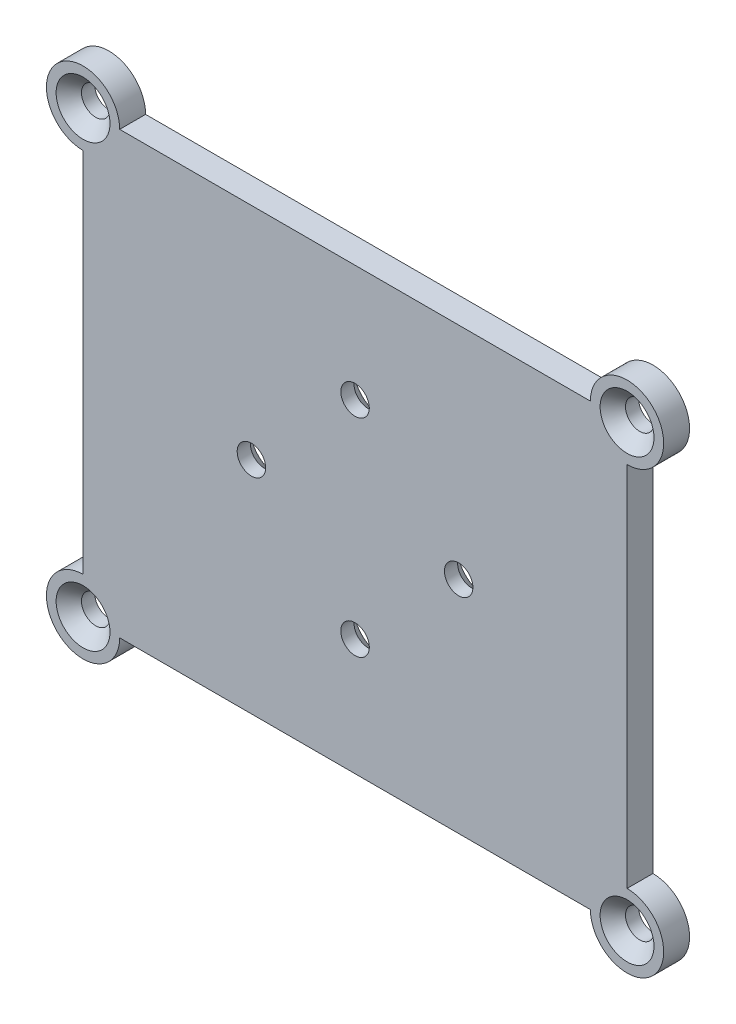
from build123d import *

# Parameters (mm, degrees)
SKETCH1_W                                      = 75
SKETCH1_H                                      = 95
SKETCH1_R                                      = 1
BOSS_EXTRUDE1_DEPTH                            = 5
CSK_FOR_M5_FLAT_HEAD_MACHINE_SCREW1_AT_2_COUNT = 2
CSK_FOR_M5_FLAT_HEAD_MACHINE_SCREW1_AT_2_PITCH = 28.284271247
CSK_FOR_M5_FLAT_HEAD_MACHINE_SCREW1_AT_3_COUNT = 2
CSK_FOR_M5_FLAT_HEAD_MACHINE_SCREW1_AT_3_PITCH = 40
CSK_FOR_M5_FLAT_HEAD_MACHINE_SCREW1_AT_4_COUNT = 2
CSK_FOR_M5_FLAT_HEAD_MACHINE_SCREW1_AT_4_PITCH = 28.284271247
SKETCH3_W                                      = 95
SKETCH3_H                                      = 75
BOSS_EXTRUDE2_DEPTH                            = 5
CSK_FOR_M5_FLAT_HEAD_MACHINE_SCREW2_AT_2_COUNT = 2
CSK_FOR_M5_FLAT_HEAD_MACHINE_SCREW2_AT_2_PITCH = 105
CSK_FOR_M5_FLAT_HEAD_MACHINE_SCREW2_AT_3_COUNT = 2
CSK_FOR_M5_FLAT_HEAD_MACHINE_SCREW2_AT_3_PITCH = 135.092560861
CSK_FOR_M5_FLAT_HEAD_MACHINE_SCREW2_AT_4_COUNT = 2
CSK_FOR_M5_FLAT_HEAD_MACHINE_SCREW2_AT_4_PITCH = 85


with BuildPart() as part:
    # Sketch1 → Boss-Extrude1 (new body)
    with BuildSketch(Plane(origin=(0, 0, 0), x_dir=(0, 1, 0), z_dir=(0, 0, 1))):
        Rectangle(SKETCH1_W, SKETCH1_H)
        with Locations((0, 20)):
            Circle(SKETCH1_R, mode=Mode.SUBTRACT)
        with Locations((20, 0)):
            Circle(SKETCH1_R, mode=Mode.SUBTRACT)
        with Locations((0, -20)):
            Circle(SKETCH1_R, mode=Mode.SUBTRACT)
        with Locations((-20, 0)):
            Circle(SKETCH1_R, mode=Mode.SUBTRACT)
    extrude(amount=BOSS_EXTRUDE1_DEPTH)

    # Sketch2 → CSK for M5 Flat Head Machine Screw1 (revolve, cut)
    with BuildSketch(Plane(origin=(0, 20, 0), x_dir=(0, 1, 0), z_dir=(1, 0, 0))):
        Polygon((0, 0), (0, 5), (2.75, 5), (2.75, 2.45), (5.2, 0), align=None)
    csk_for_m5_flat_head_machine_screw1 = revolve(axis=Axis((0, 20, -6.35), (0, 0, 1)), mode=Mode.SUBTRACT)

    # CSK for M5 Flat Head Machine Screw1 at 2: CSK for M5 Flat Head Machine Screw1 ×2
    with Locations(*[Vector(-0.7071067811865475, -0.7071067811865477, 0) * (i * CSK_FOR_M5_FLAT_HEAD_MACHINE_SCREW1_AT_2_PITCH) for i in range(1, CSK_FOR_M5_FLAT_HEAD_MACHINE_SCREW1_AT_2_COUNT)]):
        add(csk_for_m5_flat_head_machine_screw1, mode=Mode.SUBTRACT)

    # CSK for M5 Flat Head Machine Screw1 at 3: CSK for M5 Flat Head Machine Screw1 ×2
    with Locations(*[(0, -i * CSK_FOR_M5_FLAT_HEAD_MACHINE_SCREW1_AT_3_PITCH, 0) for i in range(1, CSK_FOR_M5_FLAT_HEAD_MACHINE_SCREW1_AT_3_COUNT)]):
        add(csk_for_m5_flat_head_machine_screw1, mode=Mode.SUBTRACT)

    # CSK for M5 Flat Head Machine Screw1 at 4: CSK for M5 Flat Head Machine Screw1 ×2
    with Locations(*[Vector(0.7071067811865478, -0.7071067811865472, 0) * (i * CSK_FOR_M5_FLAT_HEAD_MACHINE_SCREW1_AT_4_PITCH) for i in range(1, CSK_FOR_M5_FLAT_HEAD_MACHINE_SCREW1_AT_4_COUNT)]):
        add(csk_for_m5_flat_head_machine_screw1, mode=Mode.SUBTRACT)

    # Sketch3 → Boss-Extrude2 (add)
    with BuildSketch(Plane.XY.offset(5)):
        with BuildLine():
            ThreePointArc((-52.5, -35.428932188), (-57.5, -47.5), (-45.428932188, -42.5))
            Line((-45.428932188, -42.5), (45.428932188, -42.5))
            ThreePointArc((45.428932188, -42.5), (57.5, -47.5), (52.5, -35.428932188))
            Line((52.5, -35.428932188), (52.5, 35.428932188))
            ThreePointArc((52.5, 35.428932188), (57.5, 47.5), (45.428932188, 42.5))
            Line((45.428932188, 42.5), (-45.428932188, 42.5))
            ThreePointArc((-45.428932188, 42.5), (-57.5, 47.5), (-52.5, 35.428932188))
            Line((-52.5, 35.428932188), (-52.5, -35.428932188))
        make_face()
        Rectangle(SKETCH3_W, SKETCH3_H, mode=Mode.SUBTRACT)
    extrude(amount=-BOSS_EXTRUDE2_DEPTH)

    # Sketch5 → CSK for M5 Flat Head Machine Screw2 (revolve, cut)
    with BuildSketch(Plane(origin=(-52.5, 42.5, 5), x_dir=(0, -1, 0), z_dir=(1, 0, 0))):
        Polygon((0, 0), (0, 5), (2.75, 5), (2.75, 2.45), (5.2, 0), align=None)
    csk_for_m5_flat_head_machine_screw2 = revolve(axis=Axis((-52.5, 42.5, 11.35), (0, 0, -1)), mode=Mode.SUBTRACT)

    # CSK for M5 Flat Head Machine Screw2 at 2: CSK for M5 Flat Head Machine Screw2 ×2
    with Locations(*[(i * CSK_FOR_M5_FLAT_HEAD_MACHINE_SCREW2_AT_2_PITCH, 0, 0) for i in range(1, CSK_FOR_M5_FLAT_HEAD_MACHINE_SCREW2_AT_2_COUNT)]):
        add(csk_for_m5_flat_head_machine_screw2, mode=Mode.SUBTRACT)

    # CSK for M5 Flat Head Machine Screw2 at 3: CSK for M5 Flat Head Machine Screw2 ×2
    with Locations(*[Vector(0.7772448707074855, -0.6291982286679645, 0) * (i * CSK_FOR_M5_FLAT_HEAD_MACHINE_SCREW2_AT_3_PITCH) for i in range(1, CSK_FOR_M5_FLAT_HEAD_MACHINE_SCREW2_AT_3_COUNT)]):
        add(csk_for_m5_flat_head_machine_screw2, mode=Mode.SUBTRACT)

    # CSK for M5 Flat Head Machine Screw2 at 4: CSK for M5 Flat Head Machine Screw2 ×2
    with Locations(*[(0, -i * CSK_FOR_M5_FLAT_HEAD_MACHINE_SCREW2_AT_4_PITCH, 0) for i in range(1, CSK_FOR_M5_FLAT_HEAD_MACHINE_SCREW2_AT_4_COUNT)]):
        add(csk_for_m5_flat_head_machine_screw2, mode=Mode.SUBTRACT)


solid = part.part
